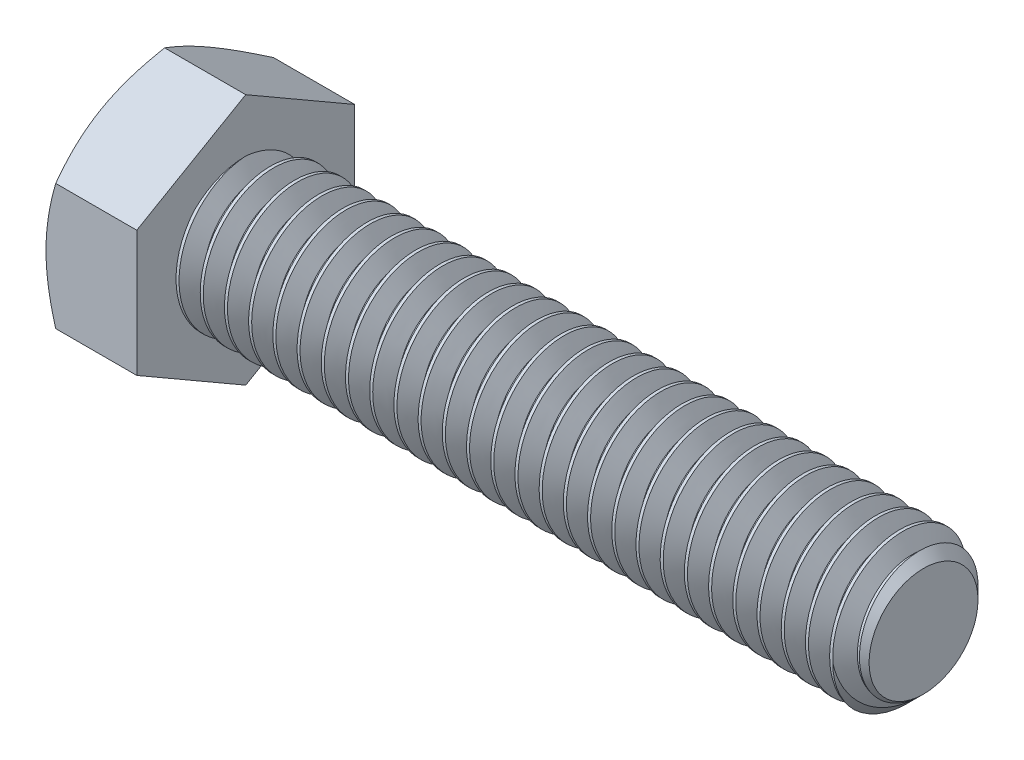
from build123d import *

# Parameters (mm, degrees)
SKETCH5_R           = 4.7625
BOSS_EXTRUDE3_DEPTH = 44.45
CHAMFER1_SIZE       = 1.190625
CUT_SWEEP1_PITCH    = 1.5875
BOSS_EXTRUDE4_DEPTH = 5.953125
SKETCH8_OUTSIDE_W   = 209.384
SKETCH8_OUTSIDE_H   = 211.594
SKETCH8_OUTSIDE_R   = 7.14375
CUT_EXTRUDE3_DEPTH  = 52.57084841
CUT_EXTRUDE3_DRAFT  = -60


with BuildPart() as part:
    # Sketch5 → Boss-Extrude3 (new body)
    with BuildSketch(Plane(origin=(25.2015625, 0, 0), x_dir=(0, 0, -1), z_dir=(1, 0, 0))):
        Circle(SKETCH5_R)
    extrude(amount=-BOSS_EXTRUDE3_DEPTH)

    # Chamfer1
    chamfer1_edges = [part.edges().sort_by_distance(p)[0] for p in [
        (25.2015625, 0, 4.7625),
    ]]
    chamfer(chamfer1_edges, length=CHAMFER1_SIZE)

    # Cut-Sweep1: arcs per turn and ends read off the stored shape
    # Cut-Sweep1: the profile of Sketch10 profile screwed along a right-hand helix through 29 turns, 8 arcs to a turn; built about Z, then put on its axis
    cut_sweep1_z = Axis((0, 0, 0), (0, 0, 1))
    cut_sweep1_corners = [(4.7628, 0, 0.000173205), (3.731388504, 0, -0.5953125), (3.731388504, 0, -0.79375), (4.7628, 0, -1.389235705)]
    with BuildLine(mode=Mode.PRIVATE) as cut_sweep1_profile:
        Line(cut_sweep1_corners[0], cut_sweep1_corners[1])
        Line(cut_sweep1_corners[1], cut_sweep1_corners[2])
        Line(cut_sweep1_corners[2], cut_sweep1_corners[3])
        Line(cut_sweep1_corners[3], cut_sweep1_corners[0])
    cut_sweep1_cap = Face(cut_sweep1_profile.wire())
    cut_sweep1_turn_angles = [0, 22.5, 45, 67.5, 90, 112.5, 135, 157.5, 180, 202.5, 225, 247.5, 270, 292.5, 315, 337.5, 360]
    cut_sweep1_turn_weights = [1, 0.9238795325112867, 1, 0.9238795325112867, 1, 0.9238795325112867, 1, 0.9238795325112867, 1, 0.9238795325112867, 1, 0.9238795325112867, 1, 0.9238795325112867, 1, 0.9238795325112867, 1]
    cut_sweep1_turn_rails = [Edge.make_bspline([Vector(p[0], p[1], 0).rotate(cut_sweep1_z, cut_sweep1_turn_angles[k]) / cut_sweep1_turn_weights[k] + Vector(0, 0, p[2] + CUT_SWEEP1_PITCH * cut_sweep1_turn_angles[k] / 360) for k in range(17)], [0, 0, 0, 1, 1, 2, 2, 3, 3, 4, 4, 5, 5, 6, 6, 7, 7, 8, 8, 8], 2, cut_sweep1_turn_weights) for p in cut_sweep1_corners]
    cut_sweep1_turn_sides = [Face.make_surface_from_curves(cut_sweep1_turn_rails[p[0]], cut_sweep1_turn_rails[p[1]]) for p in [(0, 1), (1, 2), (2, 3), (3, 0)]]
    cut_sweep1 = Plane(origin=(25.2015625, 0, 0), x_dir=(0, 1, 0), z_dir=(-1, 0, 0)) * Solid(Shell([*[p.moved(Location((0, 0, CUT_SWEEP1_PITCH * i))) for i in range(29) for p in cut_sweep1_turn_sides], cut_sweep1_cap, cut_sweep1_cap.rotate(cut_sweep1_z, 10440).moved(Location((0, 0, CUT_SWEEP1_PITCH * 10440 / 360)))]))
    add(cut_sweep1, mode=Mode.SUBTRACT)

    # Sketch6 → Boss-Extrude4 (add)
    with BuildSketch(Plane.ZY.offset(19.2484375)):
        Polygon((7.14375, 4.124445986), (0, 8.248891971), (-7.14375, 4.124445986), (-7.14375, -4.124445986), (0, -8.248891971), (7.14375, -4.124445986), align=None)
    extrude(amount=BOSS_EXTRUDE4_DEPTH)


with BuildPart() as cut_extrude3_tool:
    # Sketch8 outside → Cut-Extrude3 (with draft: the straight prism first)
    with BuildSketch(Plane.ZY.offset(25.2015625)):
        Rectangle(SKETCH8_OUTSIDE_W, SKETCH8_OUTSIDE_H)
        Circle(SKETCH8_OUTSIDE_R, mode=Mode.SUBTRACT)
    extrude(amount=-CUT_EXTRUDE3_DEPTH)
    # Cut-Extrude3: the draft: its side faces are tilted about the plane it starts from
    cut_extrude3_sides = [cut_extrude3_tool.faces().sort_by_distance(p)[0] for p in [
        (1.083861705, -105.797, 0),
        (1.083861705, 0, 104.692),
        (1.083861705, 105.797, 0),
        (1.083861705, 0, -104.692),
        (1.083861705, 0, -7.14375),
    ]]
    draft(cut_extrude3_sides, Plane.ZY.offset(25.2015625), CUT_EXTRUDE3_DRAFT)


with BuildPart() as part_1:
    add(part.part)

    # Cut-Extrude3: cut by cut_extrude3_tool
    add(cut_extrude3_tool.part, mode=Mode.SUBTRACT)


solid = part_1.part
